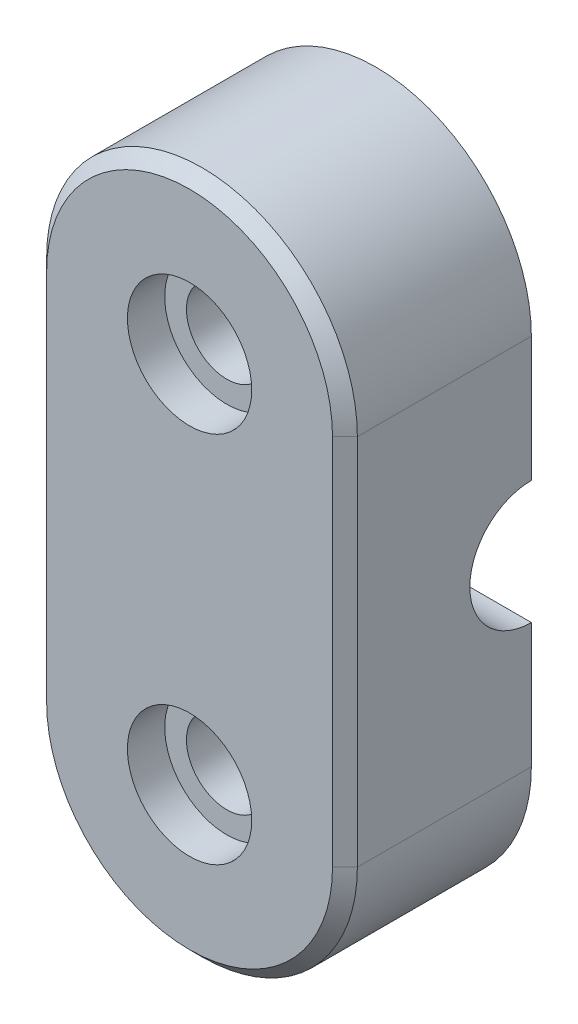
from build123d import *

# Parameters (mm, degrees)
SKETCH1_R           = 3.25
BOSS_EXTRUDE1_DEPTH = 15
CUT_EXTRUDE1_REACH  = 42.078
SKETCH2_R           = 4.95
CHAMFER1_SIZE       = 1
SKETCH3_R           = 5
CUT_EXTRUDE2_DEPTH  = 3
BOSS_EXTRUDE2_DEPTH = 0.95


with BuildPart() as part:
    # Sketch1 → Boss-Extrude1 (new body)
    with BuildSketch(Plane.XY):
        with BuildLine():
            ThreePointArc((12.5, 15), (0, 27.5), (-12.5, 15))
            Line((-12.5, 15), (-12.5, -15))
            ThreePointArc((-12.5, -15), (0, -27.5), (12.5, -15))
            Line((12.5, -15), (12.5, 15))
        make_face()
        with Locations((0, -15)):
            Circle(SKETCH1_R, mode=Mode.SUBTRACT)
        with Locations((0, 15)):
            Circle(SKETCH1_R, mode=Mode.SUBTRACT)
    extrude(amount=BOSS_EXTRUDE1_DEPTH)

    # Sketch2 → Cut-Extrude1 (cut, up to next)
    with BuildSketch(Plane(origin=(12.5, 0, 0), x_dir=(0, 0, -1), z_dir=(1, 0, 0)), mode=Mode.PRIVATE) as cut_extrude1_sk1:
        Circle(SKETCH2_R)
    cut_extrude1_tool1 = extrude(cut_extrude1_sk1.sketch, amount=-CUT_EXTRUDE1_REACH, mode=Mode.PRIVATE) & part.part
    add(cut_extrude1_tool1.solids().sort_by_distance((12.5, 0, 0))[0], mode=Mode.SUBTRACT)

    # Chamfer1
    chamfer1_edges = [part.edges().sort_by_distance(p)[0] for p in [
        (0, -27.5, 15),
        (0, 27.5, 15),
        (-12.5, 0, 15),
        (12.5, 0, 15),
    ]]
    chamfer(chamfer1_edges, length=CHAMFER1_SIZE)

    # Sketch3 → Cut-Extrude2 (cut)
    with BuildSketch(Plane.XY.offset(15)):
        with Locations((0, 15)):
            Circle(SKETCH3_R)
        with Locations((0, -15)):
            Circle(SKETCH3_R)
    extrude(amount=-CUT_EXTRUDE2_DEPTH, mode=Mode.SUBTRACT)

    # Sketch5 → Boss-Extrude2 (add, symmetric)
    with BuildSketch(Plane(origin=(0, 0, 0), x_dir=(0, 0, -1), z_dir=(1, 0, 0))):
        with BuildLine():
            Line((0, 4.5), (0, 4.95))
            ThreePointArc((0, 4.95), (-4.95, 0), (0, -4.95))
            Line((0, -4.95), (0, -4.5))
            ThreePointArc((0, -4.5), (-4.5, 0), (0, 4.5))
        make_face()
    extrude(amount=BOSS_EXTRUDE2_DEPTH, both=True)


solid = part.part
